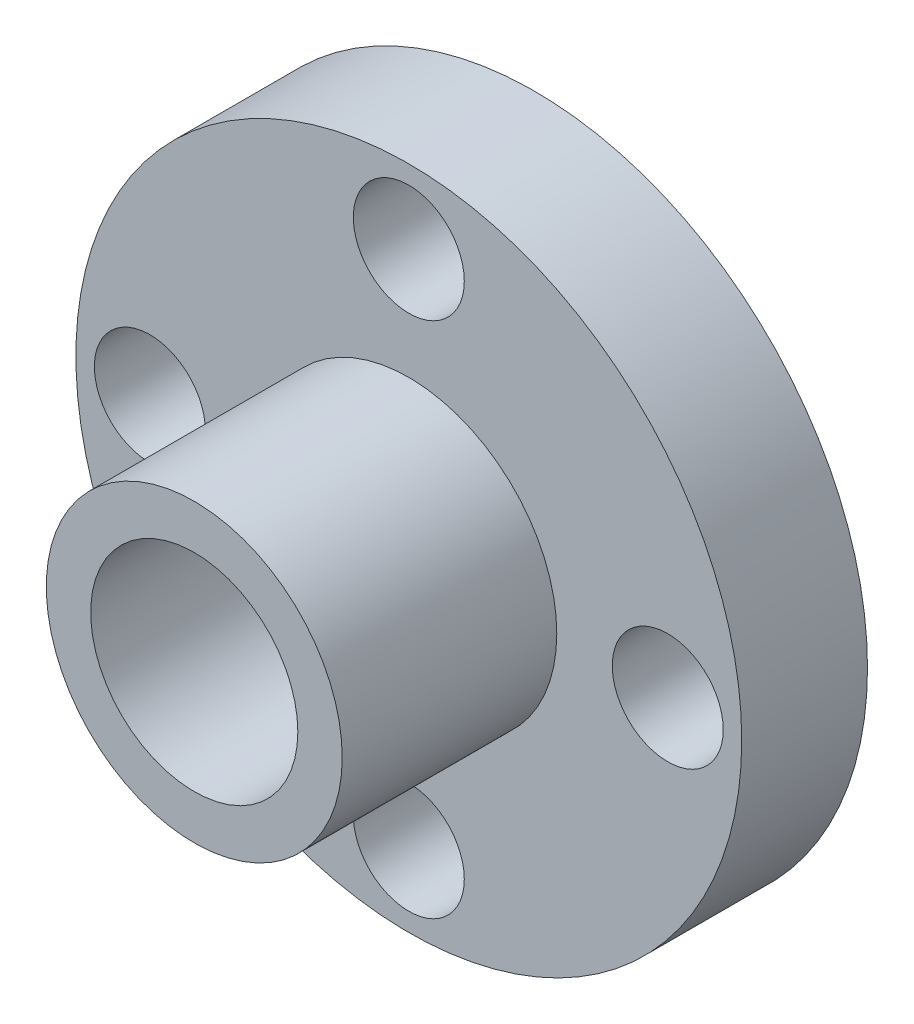
from build123d import *

# Parameters (mm, degrees)
SKETCH2_R          = 70
CUT_EXTRUDE1_DEPTH = 230
SKETCH3_R          = 37.5
CUT_EXTRUDE3_DEPTH = 350.678423698


with BuildPart() as part:
    # Sketch1 → Revolve1 (revolve)
    with BuildSketch(Plane(origin=(0, 0, 0), x_dir=(0, 0, -1), z_dir=(1, 0, 0))):
        Polygon((0, 225), (0, 100), (-145, 100), (-145, 0), (85, 0), (85, 225), align=None)
    revolve(axis=Axis((0, 0, 277.296664132), (0, 0, -1)))

    # Sketch2 → Cut-Extrude1 (cut)
    with BuildSketch(Plane.XY.offset(145)):
        Circle(SKETCH2_R)
    extrude(amount=-CUT_EXTRUDE1_DEPTH, mode=Mode.SUBTRACT)

    # Sketch3 → Cut-Extrude3 (cut, through all)
    with BuildSketch(Plane.XY):
        with Locations((0, 175)):
            Circle(SKETCH3_R)
        with Locations((175, 0)):
            Circle(SKETCH3_R)
        with Locations((0, -175)):
            Circle(SKETCH3_R)
        with Locations((-175, 0)):
            Circle(SKETCH3_R)
    extrude(amount=-CUT_EXTRUDE3_DEPTH, mode=Mode.SUBTRACT)


solid = part.part
